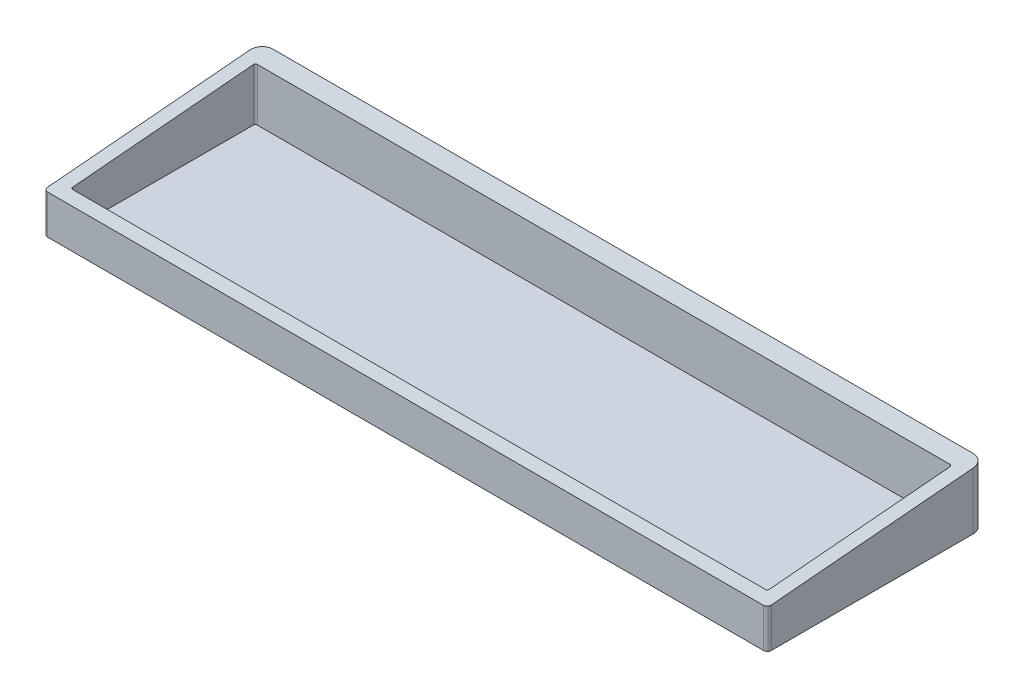
from build123d import *

# Parameters (mm, degrees)
BOSS_EXTRUDE1_DEPTH = 30
CUT_EXTRUDE1_DEPTH  = 400
BOSS_EXTRUDE2_DEPTH = 2


with BuildPart() as part:
    # Sketch2 → Boss-Extrude1 (new body)
    with BuildSketch(Plane(origin=(0, 0, 0), x_dir=(1, 0, 0), z_dir=(0, 1, 0))):
        with BuildLine():
            Line((180.825, 57.625), (-180.825, 57.625))
            ThreePointArc((-180.825, 57.625), (-185.067640687, 55.867640687), (-186.825, 51.625))
            Line((-186.825, 51.625), (-186.825, -52.625))
            ThreePointArc((-186.825, -52.625), (-186.239213562, -54.039213562), (-184.825, -54.625))
            Line((-184.825, -54.625), (184.825, -54.625))
            ThreePointArc((184.825, -54.625), (186.239213562, -54.039213562), (186.825, -52.625))
            Line((186.825, -52.625), (186.825, 51.625))
            ThreePointArc((186.825, 51.625), (185.067640687, 55.867640687), (180.825, 57.625))
        make_face()
        with BuildLine():
            Line((-179.825, -46.625), (-179.825, 46.625))
            ThreePointArc((-179.825, 46.625), (-179.532106781, 47.332106781), (-178.825, 47.625))
            Line((-178.825, 47.625), (178.825, 47.625))
            ThreePointArc((178.825, 47.625), (179.532106781, 47.332106781), (179.825, 46.625))
            Line((179.825, 46.625), (179.825, -46.625))
            ThreePointArc((179.825, -46.625), (179.532106781, -47.332106781), (178.825, -47.625))
            Line((178.825, -47.625), (-178.825, -47.625))
            ThreePointArc((-178.825, -47.625), (-179.532106781, -47.332106781), (-179.825, -46.625))
        make_face(mode=Mode.SUBTRACT)
    extrude(amount=BOSS_EXTRUDE1_DEPTH)

    # Sketch3 → Cut-Extrude1 (cut)
    with BuildSketch(Plane.ZY.offset(186.825)):
        Polygon((-57.625, 30), (54.625, 20.179397519), (54.625, 30), align=None)
    extrude(amount=-CUT_EXTRUDE1_DEPTH, mode=Mode.SUBTRACT)

    # Sketch4 → Boss-Extrude2 (add)
    with BuildSketch(Plane.XZ):
        with BuildLine():
            Line((-179.825, 46.625), (-179.825, -46.625))
            ThreePointArc((-179.825, -46.625), (-179.532106781, -47.332106781), (-178.825, -47.625))
            Line((-178.825, -47.625), (178.825, -47.625))
            ThreePointArc((178.825, -47.625), (179.532106781, -47.332106781), (179.825, -46.625))
            Line((179.825, -46.625), (179.825, 46.625))
            ThreePointArc((179.825, 46.625), (179.532106781, 47.332106781), (178.825, 47.625))
            Line((178.825, 47.625), (-178.825, 47.625))
            ThreePointArc((-178.825, 47.625), (-179.532106781, 47.332106781), (-179.825, 46.625))
        make_face()
    extrude(amount=-BOSS_EXTRUDE2_DEPTH)


solid = part.part
